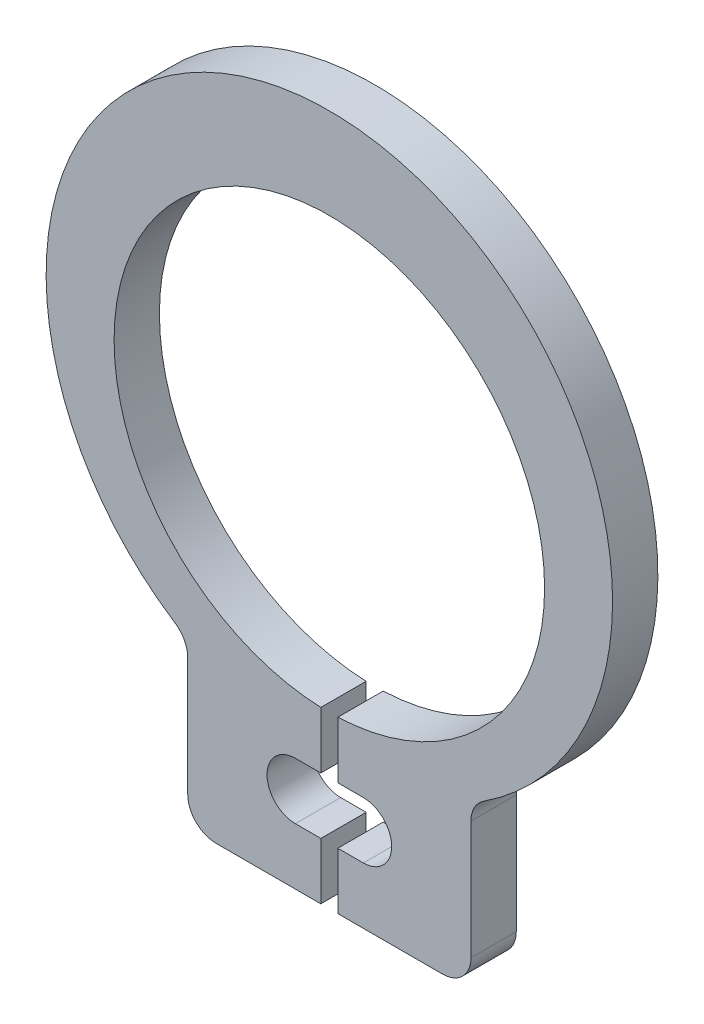
from build123d import *

# Parameters (mm, degrees)
BOSS_EXTRUDE1_DEPTH = 0.8
SKETCH2_R           = 0.5
CUT_EXTRUDE1_DEPTH  = 9.478207358
DELETEFACE1_DEPTH   = 0.8
CUT_EXTRUDE2_DEPTH  = 9.478207358


# Read off the part's stored shape, not the designer's step: DeleteFace1
with BuildPart() as part:
    # Sketch1 → Boss-Extrude1 (new body)
    with BuildSketch(Plane.XY):
        with BuildLine():
            Line((-2.5, -4.209772229), (-2.5, -6.3))
            ThreePointArc((-2.5, -6.3), (-2.353553391, -6.653553391), (-2, -6.8))
            Line((-2, -6.8), (-0.15, -6.8))
            Line((-0.15, -6.8), (-0.15, -3.79703832))
            ThreePointArc((-0.15, -3.79703832), (0, 3.8), (0.15, -3.79703832))
            Line((0.15, -3.79703832), (0.15, -6.8))
            Line((0.15, -6.8), (2, -6.8))
            ThreePointArc((2, -6.8), (2.353553391, -6.653553391), (2.5, -6.3))
            Line((2.5, -6.3), (2.5, -4.209772229))
            ThreePointArc((2.5, -4.209772229), (2.560475464, -3.971406581), (2.727272727, -3.790702026))
            ThreePointArc((2.727272727, -3.790702026), (0, 5.4), (-2.727272727, -3.790702026))
            ThreePointArc((-2.727272727, -3.790702026), (-2.560475464, -3.971406581), (-2.5, -4.209772229))
        make_face()
    extrude(amount=BOSS_EXTRUDE1_DEPTH)

    # Sketch2 → Cut-Extrude1 (cut, through all)
    with BuildSketch(Plane(origin=(0, 0, 0), x_dir=(-1, 0, 0), z_dir=(0, 0, -1))):
        with Locations((-0.6, -5.3)):
            Circle(SKETCH2_R)
        with Locations((0.6, -5.3)):
            Circle(SKETCH2_R)
    extrude(amount=-CUT_EXTRUDE1_DEPTH, mode=Mode.SUBTRACT)

    # DeleteFace1 outline → DeleteFace1 (add)
    with BuildSketch(Plane.XY):
        with BuildLine():
            Line((-0.15, -5.517944947), (-0.15, -5.082055053))
            ThreePointArc((-0.15, -5.082055053), (-1.1, -5.3), (-0.15, -5.517944947))
        make_face()
        with BuildLine():
            Line((0.15, -5.082055053), (0.15, -5.517944947))
            ThreePointArc((0.15, -5.517944947), (1.1, -5.3), (0.15, -5.082055053))
        make_face()
    extrude(amount=DELETEFACE1_DEPTH)

    # Sketch3 → Cut-Extrude2 (cut, through all)
    with BuildSketch(Plane(origin=(0, 0, 0), x_dir=(-1, 0, 0), z_dir=(0, 0, -1))):
        with BuildLine():
            Line((-0.6, -4.8), (0.6, -4.8))
            ThreePointArc((0.6, -4.8), (1.1, -5.3), (0.6, -5.8))
            Line((0.6, -5.8), (-0.6, -5.8))
            ThreePointArc((-0.6, -5.8), (-1.1, -5.3), (-0.6, -4.8))
        make_face()
    extrude(amount=-CUT_EXTRUDE2_DEPTH, mode=Mode.SUBTRACT)


solid = part.part
